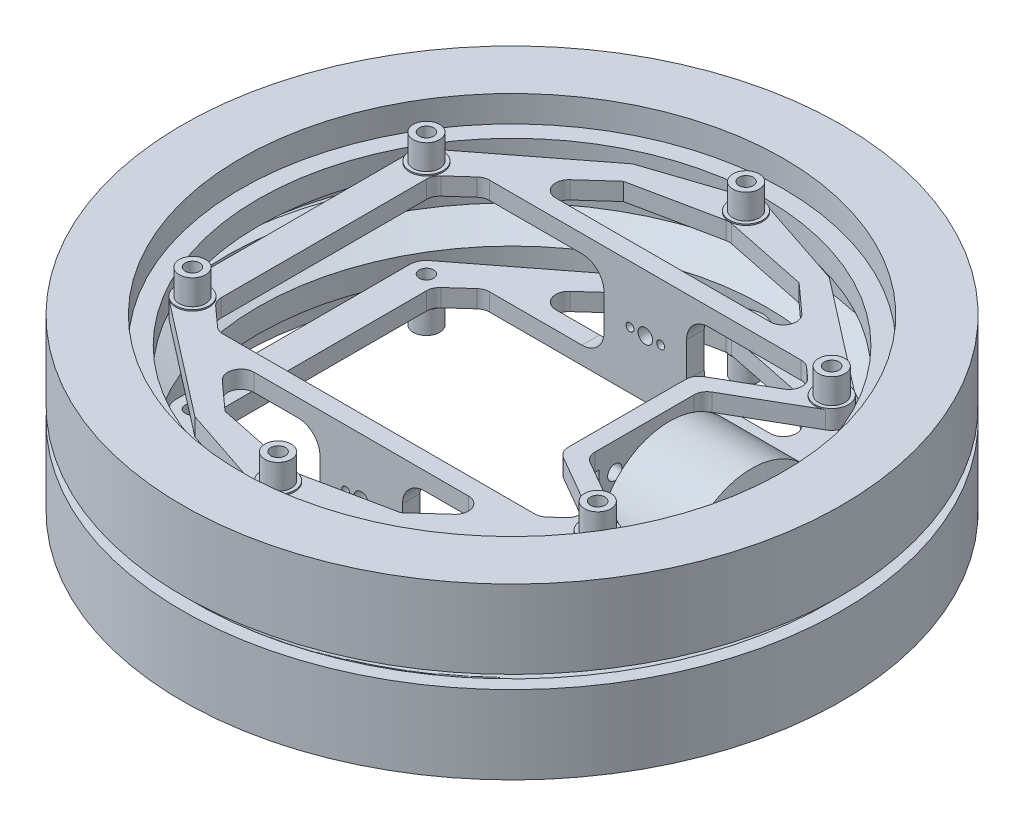
from build123d import *

# Parameters (mm, degrees)
BOSS_EXTRUDE1_START       = 9
SKETCH4_R                 = 1.65
BOSS_EXTRUDE1_DEPTH       = 4
BOSS_EXTRUDE5_START       = 8.9999999
BOSS_EXTRUDE5_OUTLINE_R   = 1.65
BOSS_EXTRUDE5_OUTLINE_R_2 = 3.8
BOSS_EXTRUDE5_DEPTH       = 4.3000001
BOSS_EXTRUDE6_START       = 13
SKETCH4_4_R               = 3
SKETCH4_4_R_2             = 1.65
BOSS_EXTRUDE6_DEPTH       = 6
FILLET2_R                 = 3
SKETCH7_W                 = 20.770384182
SKETCH7_H                 = 18
SKETCH7_R                 = 1.65
BOSS_EXTRUDE7_DEPTH       = 4
SKETCH8_W                 = 18.8
SKETCH8_H                 = 18
SKETCH8_R                 = 1.65
SKETCH8_R_2               = 0.9
BOSS_EXTRUDE8_DEPTH       = 4
FILLET1_R                 = 5


with BuildPart() as part:
    # Sketch3 → Revolve1 (revolve)
    with BuildSketch(Plane.XY, mode=Mode.PRIVATE) as revolve1_sk:
        with BuildLine():
            Line((65, 4.560090333), (65, 1.5))
            Line((65, 1.5), (68, 1.5))
            ThreePointArc((68, 1.5), (70, 2.5), (72, 1.5))
            Line((72, 1.5), (75, 1.5))
            Line((75, 1.5), (75, 19.3))
            Line((75, 19.3), (61.749537704, 19.3))
            Line((61.749537704, 19.3), (61.749537704, 13.3))
            Line((61.749537704, 13.3), (57.749537704, 13.3))
            Line((57.749537704, 13.3), (57.749537704, 7.941036427))
            Line((57.749537704, 7.941036427), (65, 4.560090333))
        make_face()
        with BuildLine():
            ThreePointArc((72, -1.5), (70, -2.5), (68, -1.5))
            Line((68, -1.5), (65, -1.5))
            Line((65, -1.5), (65, -4.560090333))
            Line((65, -4.560090333), (57.749537704, -7.941036427))
            Line((57.749537704, -7.941036427), (57.749537704, -13.3))
            Line((57.749537704, -13.3), (61.749537704, -13.3))
            Line((61.749537704, -13.3), (61.749537704, -19.3))
            Line((61.749537704, -19.3), (75, -19.3))
            Line((75, -19.3), (75, -1.5))
            Line((75, -1.5), (72, -1.5))
        make_face()
    revolve(revolve1_sk.sketch.rotate(Axis((0, -45.492304176, 0), (0, 1, 0)), 90), axis=Axis((0, -45.492304176, 0), (0, 1, 0)))


with BuildPart() as body_2:
    # Sketch3<3> → Revolve2 (revolve)
    with BuildSketch(Plane.XY, mode=Mode.PRIVATE) as revolve2_sk:
        Polygon((64.5, 7), (57.249537704, 10.380946094), (54.489437538, 16.3), (35.845072927, 16.3), (35.845072927, 13.8), (52.345072927, 13.8), (57.381195635, 3), (64.5, 3), align=None)
        Polygon((57.749537704, 7.941036427), (64.5, 4.793244162), (64.5, 7), (57.749537704, 10.147792265), align=None)
    revolve(revolve2_sk.sketch.rotate(Axis((0, 0, 0), (1, 0, 0)), 90), axis=Axis((0, 0, 0), (1, 0, 0)))


with BuildPart() as body_3:
    # Sketch4 → Boss-Extrude1 (new body)
    with BuildSketch(Plane(origin=(0, 0, 0), x_dir=(1, 0, 0), z_dir=(0, 1, 0)).offset(BOSS_EXTRUDE1_START)):
        with BuildLine():
            Line((22.387618867, -49.796528801), (48.441429286, -29.629736653))
            ThreePointArc((48.441429286, -29.629736653), (49.90678423, -26.368248114), (48.015452391, -23.333872317))
            Line((48.015452391, -23.333872317), (30.130072927, -13.007743669))
            Line((30.130072927, -13.007743669), (30.130072927, 13.007743669))
            Line((30.130072927, 13.007743669), (48.015452391, 23.333872317))
            ThreePointArc((48.015452391, 23.333872317), (49.90678423, 26.368248114), (48.441429286, 29.629736653))
            Line((48.441429286, 29.629736653), (22.387618867, 49.796528801))
            Line((22.387618867, 49.796528801), (1.201056107, 56.854737314))
            ThreePointArc((1.201056107, 56.854737314), (0, 57.049537704), (-1.201056107, 56.854737314))
            Line((-1.201056107, 56.854737314), (-22.387618867, 49.796528801))
            Line((-22.387618867, 49.796528801), (-48.441429286, 29.629736653))
            ThreePointArc((-48.441429286, 29.629736653), (-49.527102447, 28.298281296), (-49.915452391, 26.624768852))
            Line((-49.915452391, 26.624768852), (-49.915452391, -26.624768852))
            ThreePointArc((-49.915452391, -26.624768852), (-49.527102447, -28.298281296), (-48.441429286, -29.629736653))
            Line((-48.441429286, -29.629736653), (-22.387618867, -49.796528801))
            Line((-22.387618867, -49.796528801), (-1.201056107, -56.854737314))
            ThreePointArc((-1.201056107, -56.854737314), (0, -57.049537704), (1.201056107, -56.854737314))
            Line((1.201056107, -56.854737314), (22.387618867, -49.796528801))
        make_face()
        Polygon((0, -49.449537704), (-20, -45.321787448), (-32.189633818, -34.321787448), (32.189633818, -34.321787448), (20, -45.321787448), align=None, mode=Mode.SUBTRACT)
        Polygon((42.824555857, -24.724768852), (36.622227933, -30.321787448), (-36.622227933, -30.321787448), (-42.824555857, -24.724768852), (-42.824555857, 24.724768852), (-36.622227933, 30.321787448), (36.622227933, 30.321787448), (42.824555857, 24.724768852), (26.130072927, 15.086204638), (26.130072927, -15.086204638), align=None, mode=Mode.SUBTRACT)
        Polygon((-32.189633818, 34.321787448), (-20, 45.321787448), (0, 49.449537704), (20, 45.321787448), (32.189633818, 34.321787448), align=None, mode=Mode.SUBTRACT)
        with Locations(Location((0, 53.249537704, 0), (0, 0, 270))):
            Circle(SKETCH4_R, mode=Mode.SUBTRACT)
        with Locations(Location((46.115452391, 26.624768852, 0), (0, 0, 270))):
            Circle(SKETCH4_R, mode=Mode.SUBTRACT)
        with Locations(Location((46.115452391, -26.624768852, 0), (0, 0, 270))):
            Circle(SKETCH4_R, mode=Mode.SUBTRACT)
        with Locations(Location((0, -53.249537704, 0), (0, 0, 270))):
            Circle(SKETCH4_R, mode=Mode.SUBTRACT)
        with Locations(Location((-46.115452391, -26.624768852, 0), (0, 0, 270))):
            Circle(SKETCH4_R, mode=Mode.SUBTRACT)
        with Locations(Location((-46.115452391, 26.624768852, 0), (0, 0, 270))):
            Circle(SKETCH4_R, mode=Mode.SUBTRACT)
    extrude(amount=BOSS_EXTRUDE1_DEPTH)

    # Boss-Extrude5: read off the stored shape, not the designer's step
    # Boss-Extrude5 outline → Boss-Extrude5 (add)
    # profile 1 of 6: a face of its own
    with BuildSketch(Plane(origin=(0, 0, 0), x_dir=(1, 0, 0), z_dir=(0, 1, 0)).offset(BOSS_EXTRUDE5_START)):
        with BuildLine():
            ThreePointArc((1.201056107, -56.854737314), (0, -49.449537704), (-1.201056107, -56.854737314))
            ThreePointArc((-1.201056107, -56.854737314), (0, -57.049537704), (1.201056107, -56.854737314))
        make_face()
        with Locations((0, -53.249537704)):
            Circle(BOSS_EXTRUDE5_OUTLINE_R, mode=Mode.SUBTRACT)
    # profile 2 of 6: a face of its own
    with BuildSketch(Plane(origin=(0, 0, 0), x_dir=(1, 0, 0), z_dir=(0, 1, 0)).offset(BOSS_EXTRUDE5_START)):
        with Locations((46.115452391, -26.624768852)):
            Circle(BOSS_EXTRUDE5_OUTLINE_R_2)
        with Locations((46.115452391, -26.624768852)):
            Circle(BOSS_EXTRUDE5_OUTLINE_R, mode=Mode.SUBTRACT)
    # profile 3 of 6: a face of its own
    with BuildSketch(Plane(origin=(0, 0, 0), x_dir=(1, 0, 0), z_dir=(0, 1, 0)).offset(BOSS_EXTRUDE5_START)):
        with Locations((46.115452391, 26.624768852)):
            Circle(BOSS_EXTRUDE5_OUTLINE_R_2)
        with Locations((46.115452391, 26.624768852)):
            Circle(BOSS_EXTRUDE5_OUTLINE_R, mode=Mode.SUBTRACT)
    # profile 4 of 6: a face of its own
    with BuildSketch(Plane(origin=(0, 0, 0), x_dir=(1, 0, 0), z_dir=(0, 1, 0)).offset(BOSS_EXTRUDE5_START)):
        with BuildLine():
            ThreePointArc((-1.201056107, 56.854737314), (0, 49.449537704), (1.201056107, 56.854737314))
            ThreePointArc((1.201056107, 56.854737314), (0, 57.049537704), (-1.201056107, 56.854737314))
        make_face()
        with Locations((0, 53.249537704)):
            Circle(BOSS_EXTRUDE5_OUTLINE_R, mode=Mode.SUBTRACT)
    # profile 5 of 6: a face of its own
    with BuildSketch(Plane(origin=(0, 0, 0), x_dir=(1, 0, 0), z_dir=(0, 1, 0)).offset(BOSS_EXTRUDE5_START)):
        with BuildLine():
            ThreePointArc((-49.915452391, 26.624768852), (-42.703802336, 24.951256408), (-48.441429286, 29.629736653))
            ThreePointArc((-48.441429286, 29.629736653), (-49.527102447, 28.298281296), (-49.915452391, 26.624768852))
        make_face()
        with Locations((-46.115452391, 26.624768852)):
            Circle(BOSS_EXTRUDE5_OUTLINE_R, mode=Mode.SUBTRACT)
    # profile 6 of 6: a face of its own
    with BuildSketch(Plane(origin=(0, 0, 0), x_dir=(1, 0, 0), z_dir=(0, 1, 0)).offset(BOSS_EXTRUDE5_START)):
        with BuildLine():
            ThreePointArc((-48.441429286, -29.629736653), (-42.703802336, -24.951256408), (-49.915452391, -26.624768852))
            ThreePointArc((-49.915452391, -26.624768852), (-49.527102447, -28.298281296), (-48.441429286, -29.629736653))
        make_face()
        with Locations((-46.115452391, -26.624768852)):
            Circle(BOSS_EXTRUDE5_OUTLINE_R, mode=Mode.SUBTRACT)
    extrude(amount=BOSS_EXTRUDE5_DEPTH)

    # Sketch4<4> → Boss-Extrude6 (add)
    # profile 1 of 6: a face of its own
    with BuildSketch(Plane(origin=(0, 0, 0), x_dir=(1, 0, 0), z_dir=(0, 1, 0)).offset(BOSS_EXTRUDE6_START)):
        with Locations(Location((-46.115452391, 26.624768852, 0), (0, 0, 90))):
            Circle(SKETCH4_4_R)
        with Locations(Location((-46.115452391, 26.624768852, 0), (0, 0, 270))):
            Circle(SKETCH4_4_R_2, mode=Mode.SUBTRACT)
    # profile 2 of 6: a face of its own
    with BuildSketch(Plane(origin=(0, 0, 0), x_dir=(1, 0, 0), z_dir=(0, 1, 0)).offset(BOSS_EXTRUDE6_START)):
        with Locations(Location((-46.115452391, -26.624768852, 0), (0, 0, 90))):
            Circle(SKETCH4_4_R)
        with Locations(Location((-46.115452391, -26.624768852, 0), (0, 0, 270))):
            Circle(SKETCH4_4_R_2, mode=Mode.SUBTRACT)
    # profile 3 of 6: a face of its own
    with BuildSketch(Plane(origin=(0, 0, 0), x_dir=(1, 0, 0), z_dir=(0, 1, 0)).offset(BOSS_EXTRUDE6_START)):
        with Locations(Location((0, -53.249537704, 0), (0, 0, 90))):
            Circle(SKETCH4_4_R)
        with Locations(Location((0, -53.249537704, 0), (0, 0, 270))):
            Circle(SKETCH4_4_R_2, mode=Mode.SUBTRACT)
    # profile 4 of 6: a face of its own
    with BuildSketch(Plane(origin=(0, 0, 0), x_dir=(1, 0, 0), z_dir=(0, 1, 0)).offset(BOSS_EXTRUDE6_START)):
        with Locations(Location((46.115452391, -26.624768852, 0), (0, 0, 90))):
            Circle(SKETCH4_4_R)
        with Locations(Location((46.115452391, -26.624768852, 0), (0, 0, 270))):
            Circle(SKETCH4_4_R_2, mode=Mode.SUBTRACT)
    # profile 5 of 6: a face of its own
    with BuildSketch(Plane(origin=(0, 0, 0), x_dir=(1, 0, 0), z_dir=(0, 1, 0)).offset(BOSS_EXTRUDE6_START)):
        with Locations(Location((46.115452391, 26.624768852, 0), (0, 0, 90))):
            Circle(SKETCH4_4_R)
        with Locations(Location((46.115452391, 26.624768852, 0), (0, 0, 270))):
            Circle(SKETCH4_4_R_2, mode=Mode.SUBTRACT)
    # profile 6 of 6: a face of its own
    with BuildSketch(Plane(origin=(0, 0, 0), x_dir=(1, 0, 0), z_dir=(0, 1, 0)).offset(BOSS_EXTRUDE6_START)):
        with Locations(Location((0, 53.249537704, 0), (0, 0, 90))):
            Circle(SKETCH4_4_R)
        with Locations(Location((0, 53.249537704, 0), (0, 0, 270))):
            Circle(SKETCH4_4_R_2, mode=Mode.SUBTRACT)
    extrude(amount=BOSS_EXTRUDE6_DEPTH)

    # Fillet2
    fillet2_edges = [body_3.edges().sort_by_distance(p)[0] for p in [
        (32.189633818, 11, -34.321787448),
        (0, 11, -49.449537704),
        (-32.189633818, 11, -34.321787448),
        (0, 11, 49.449537704),
        (32.189633818, 11, 34.321787448),
        (-32.189633818, 11, 34.321787448),
        (36.622227933, 11, 30.321787448),
        (42.824555857, 11, 24.724768852),
        (26.130072927, 11, 15.086204638),
        (26.130072927, 11, -15.086204638),
        (42.824555857, 11, -24.724768852),
        (36.622227933, 11, -30.321787448),
        (-36.622227933, 11, -30.321787448),
        (-42.824555857, 11, -24.724768852),
        (-42.824555857, 11, 24.724768852),
        (-36.622227933, 11, 30.321787448),
        (30.130072927, 11, -13.007743669),
        (30.130072927, 11, 13.007743669),
    ]]
    fillet(fillet2_edges, radius=FILLET2_R)


with BuildPart() as body_4:
    # Mirror2: mirrored copy
    add(body_3.part.mirror(Plane.ZX))


with BuildPart() as body_3_1:
    add(body_3.part)

    add(body_4.part)  # Boss-Extrude7 merges body 4
    # Sketch7 → Boss-Extrude7 (add)
    with BuildSketch(Plane.ZY.offset(-26.130072927)):
        Rectangle(SKETCH7_W, SKETCH7_H)
        with Locations((6.735192091, 6.735192091)):
            Circle(SKETCH7_R, mode=Mode.SUBTRACT)
        with Locations((-5.550788232, 5.550788232)):
            Circle(SKETCH7_R, mode=Mode.SUBTRACT)
        with Locations((-6.735192091, -6.735192091)):
            Circle(SKETCH7_R, mode=Mode.SUBTRACT)
        with Locations((5.550788232, -5.550788232)):
            Circle(SKETCH7_R, mode=Mode.SUBTRACT)
    extrude(amount=-BOSS_EXTRUDE7_DEPTH)

    # Sketch8 → Boss-Extrude8 (add)
    with BuildSketch(Plane.XY.offset(-30.321787448)):
        Rectangle(SKETCH8_W, SKETCH8_H)
        Circle(SKETCH8_R, mode=Mode.SUBTRACT)
        with Locations((-3.5, 0)):
            Circle(SKETCH8_R_2, mode=Mode.SUBTRACT)
        with Locations((3.5, 0)):
            Circle(SKETCH8_R_2, mode=Mode.SUBTRACT)
    boss_extrude8 = extrude(amount=-BOSS_EXTRUDE8_DEPTH)

    # Mirror4: Boss-Extrude8 across plane
    add(boss_extrude8.mirror(Plane.XY))

    # Fillet1
    fillet1_edges = [body_3_1.edges().sort_by_distance(p)[0] for p in [
        (9.4, 9, -32.321787448),
        (9.4, -9, -32.321787448),
        (-9.4, -9, -32.321787448),
        (-9.4, 9, -32.321787448),
        (9.4, -9, 32.321787448),
        (9.4, 9, 32.321787448),
        (-9.4, 9, 32.321787448),
        (-9.4, -9, 32.321787448),
    ]]
    fillet(fillet1_edges, radius=FILLET1_R)


solid = Compound([part.part, body_2.part, body_3_1.part])
